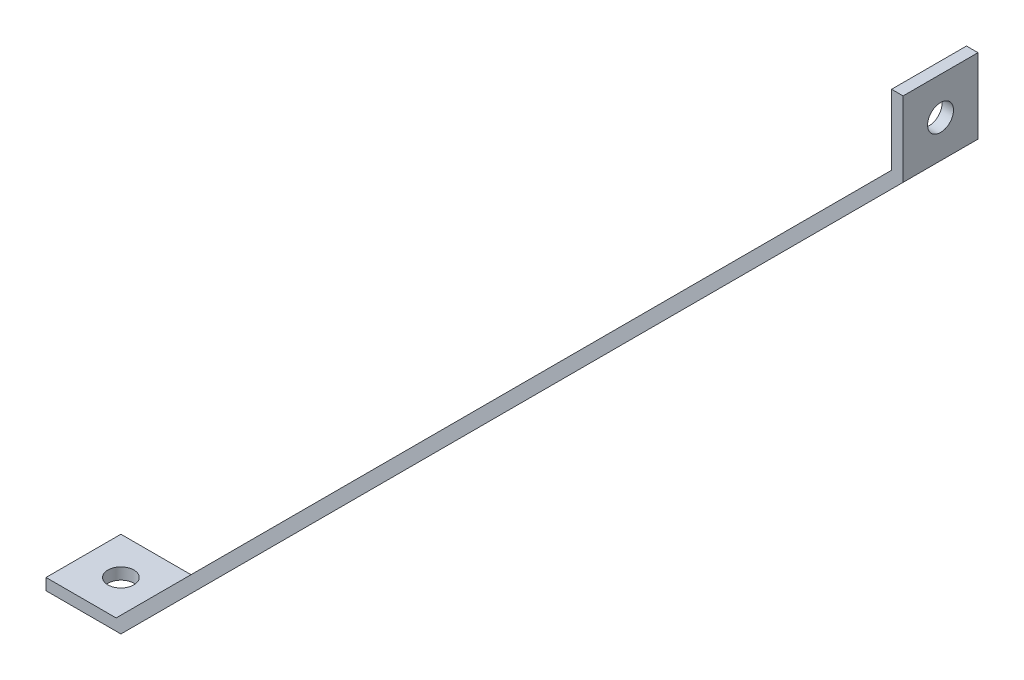
from build123d import *

# Parameters (mm, degrees)
EXTRUDE_THIN1_DEPTH = 20.6375
SKETCH2_R           = 7.14375
CUT_EXTRUDE1_DEPTH  = 533.454292692
SKETCH3_R           = 7.14375
CUT_EXTRUDE2_DEPTH  = 533.454292692


with BuildPart() as part:
    # Sketch1 → Extrude-Thin1 (new, symmetric)
    with BuildSketch(Plane.XY):
        Polygon((-256.801146906, -215.526146906), (-215.526146906, -215.526146906), (215.526146906, 215.526146906), (215.526146906, 256.801146906), (209.176146906, 256.801146906), (209.176146906, 218.156403027), (-218.156403027, -209.176146906), (-256.801146906, -209.176146906), align=None)
    extrude(amount=EXTRUDE_THIN1_DEPTH, both=True)

    # Sketch2 → Cut-Extrude1 (cut, through all)
    with BuildSketch(Plane(origin=(0, -209.176146906, 0), x_dir=(1, 0, 0), z_dir=(0, 1, 0))):
        with Locations((-236.163646906, 0)):
            Circle(SKETCH2_R)
    extrude(amount=-CUT_EXTRUDE1_DEPTH, mode=Mode.SUBTRACT)

    # Sketch3 → Cut-Extrude2 (cut, through all)
    with BuildSketch(Plane.ZY.offset(-209.176146906)):
        with Locations((0, 236.163646906)):
            Circle(SKETCH3_R)
    extrude(amount=-CUT_EXTRUDE2_DEPTH, mode=Mode.SUBTRACT)


solid = part.part
